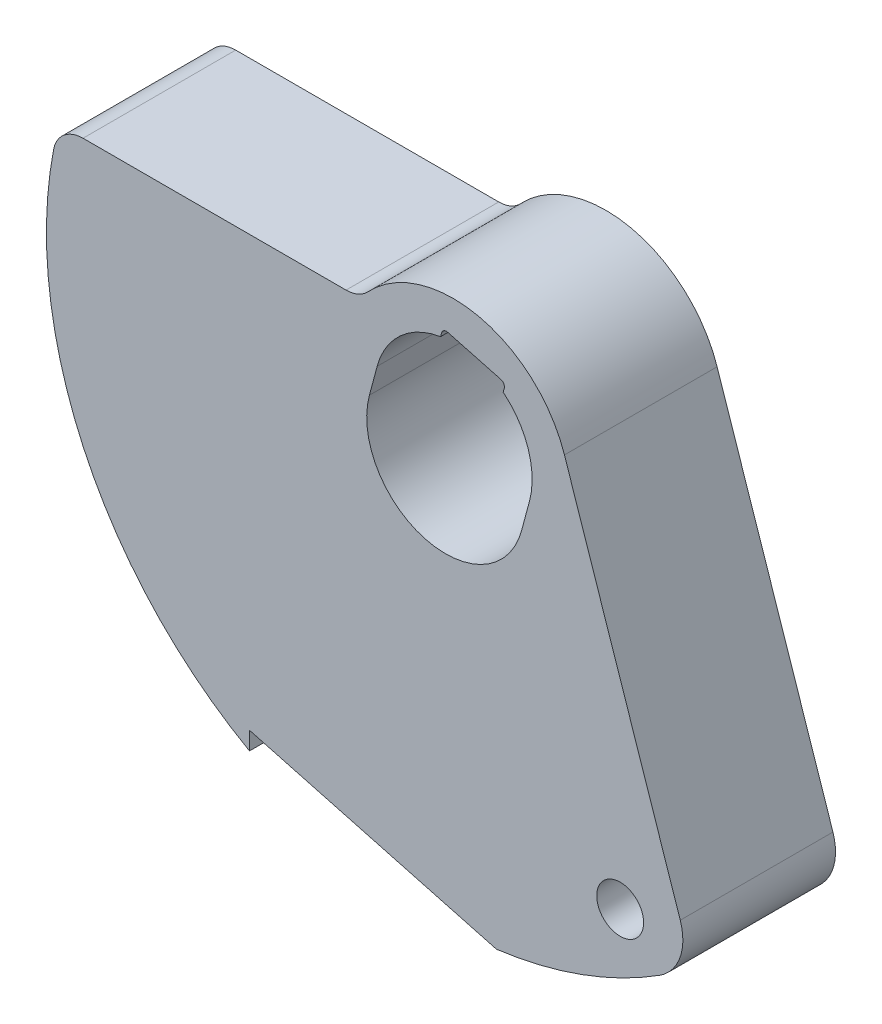
from build123d import *

# Parameters (mm, degrees)
SKETCH1_R               = 1.1938
BOSS_EXTRUDE1_DEPTH     = 7.7724
CUT_EXTRUDE1_DEPTH      = 30.656212081
CUT_EXTRUDE1_DEPTH_BACK = 30.656212081
FILLET1_R               = 2.54


with BuildPart() as part:
    # Sketch1 → Boss-Extrude1 (new body)
    with BuildSketch(Plane.XY):
        with BuildLine():
            ThreePointArc((-3.95481445, 5.560217822), (-4.460344292, 5.205196933), (-5.065262452, 5.08))
            Line((-5.065262452, 5.08), (-18.456556559, 5.08))
            ThreePointArc((-18.456556559, 5.08), (-19.426909517, 4.731155792), (-19.953034117, 3.844324324))
            ThreePointArc((-19.953034117, 3.844324324), (-18.44069754, -8.534815418), (-9.9822, -17.699098371))
            Line((-9.9822, -17.699098371), (-9.9822, -16.784328658))
            Line((-9.9822, -16.784328658), (2.593084415, -20.153865962))
            ThreePointArc((2.593084415, -20.153865962), (10.900004065, -17.149119843), (17.146958643, -10.903403565))
            Line((17.146958643, -10.903403565), (12.940315476, -3.61728387))
            ThreePointArc((12.940315476, -3.61728387), (12.796393961, -3.475289825), (12.60008731, -3.426922378))
            ThreePointArc((12.60008731, -3.426922378), (9.17217903, -2.398369889), (7.028137334, 0.467212181))
            Line((7.028137334, 0.467212181), (6.053096787, 3.371693793))
            ThreePointArc((6.053096787, 3.371693793), (1.669604011, 7.303273092), (-3.95481445, 5.560217822))
        make_face()
        with Locations((8.89, -15.24)):
            Circle(SKETCH1_R, mode=Mode.SUBTRACT)
        with BuildLine():
            ThreePointArc((3.876453526, -1.038692592), (-1.038692592, -3.876453526), (-3.876453526, 1.038692592))
            Line((-3.876453526, 1.038692592), (-3.482013301, 2.510763551))
            ThreePointArc((-3.482013301, 2.510763551), (-2.298514325, 4.447599489), (-0.253578298, 5.432607064))
            Line((-0.253578298, 5.432607064), (-0.201054745, 5.628627633))
            ThreePointArc((-0.201054745, 5.628627633), (-0.082709585, 5.782858048), (0.110030452, 5.808232755))
            Line((0.110030452, 5.808232755), (2.808827211, 5.085092343))
            ThreePointArc((2.808827211, 5.085092343), (2.963057626, 4.966747183), (2.988432333, 4.774007146))
            Line((2.988432333, 4.774007146), (2.93590878, 4.577986577))
            ThreePointArc((2.93590878, 4.577986577), (4.214371541, 2.702476981), (4.270893751, 0.433378367))
            Line((4.270893751, 0.433378367), (3.876453526, -1.038692592))
        make_face(mode=Mode.SUBTRACT)
    extrude(amount=-BOSS_EXTRUDE1_DEPTH)

    # Sketch2 → Cut-Extrude1 (cut, two sides: drawn at the far end of the back side and taken through both)
    with BuildSketch(Plane.XY.offset(-CUT_EXTRUDE1_DEPTH_BACK)):
        Polygon((-21.844195139, 86.473029104), (7.028137334, 0.467212181), (12.549933302, -15.98128825), (41.422265775, -101.987105173), (213.433899622, -44.242440226), (150.167438707, 144.217694051), align=None)
    extrude(amount=CUT_EXTRUDE1_DEPTH + CUT_EXTRUDE1_DEPTH_BACK, mode=Mode.SUBTRACT)

    # Fillet1
    fillet1_edges = [part.edges().sort_by_distance(p)[0] for p in [
        (12.549933302, -15.98128825, -3.8862),
    ]]
    fillet(fillet1_edges, radius=FILLET1_R)


solid = part.part
